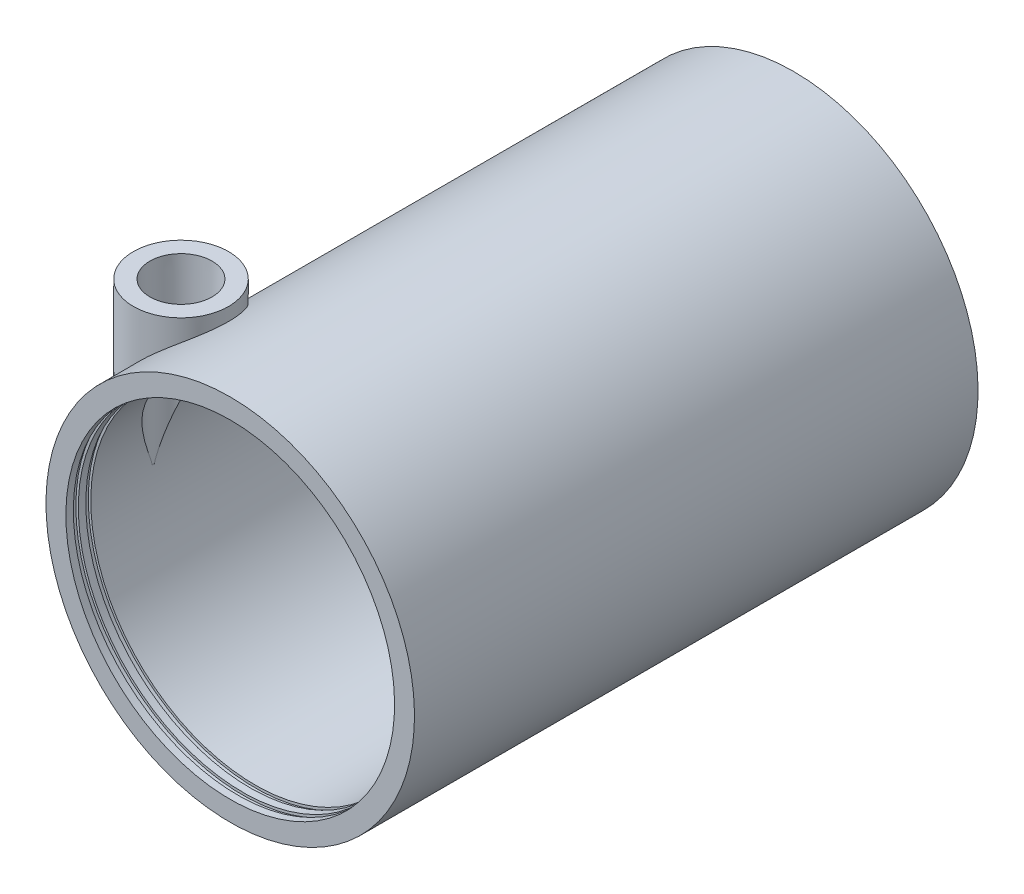
from build123d import *

# Parameters (mm, degrees)
SKETCH2_W                    = 1
SKETCH2_H                    = 0.5
WELD_BUNGS_INLET_REACH       = 161.673
WELD_START                   = 35
SKETCH3_R                    = 9.55625
WELD_BUNGS_OUTLET_REACH      = 161.673
WELD_BUNGS_OUTLET_END_RADIUS = 37
WELD_START_2                 = -35
SKETCH6_R                    = 9.55625


with BuildPart() as part:
    # Sketch1 → Main Base (revolve)
    with BuildSketch(Plane(origin=(0, 0, 0), x_dir=(0, 0, -1), z_dir=(1, 0, 0))):
        Polygon((0, 33), (109.16124, 33), (109.16124, 12.486702), (113.16124, 13.55849877), (113.16124, 37), (0, 37), align=None)
    revolve(axis=Axis((0, 0, -1.789473684), (0, 0, 1)))

    # Sketch2 → Radial O-Ring (revolve, cut)
    with BuildSketch(Plane(origin=(0, 0, 0), x_dir=(0, 0, -1), z_dir=(1, 0, 0)), mode=Mode.PRIVATE) as radial_o_ring_sk:
        with Locations((2, 33.25)):
            Rectangle(SKETCH2_W, SKETCH2_H)
        with Locations((4.5, 33.25)):
            Rectangle(SKETCH2_W, SKETCH2_H)
    revolve(radial_o_ring_sk.sketch.rotate(Axis((0, 0, 55), (0, 0, -1)), 90), axis=Axis((0, 0, 55), (0, 0, -1)), mode=Mode.SUBTRACT)

    # Sketch3 → Weld Bungs Inlet (add, up to next)
    with BuildSketch(Plane(origin=(0, 0, 0), x_dir=(1, 0, 0), z_dir=(0, 1, 0)).offset(WELD_START), mode=Mode.PRIVATE) as weld_bungs_inlet_sk1:
        with Locations(Location((-27.44375, 17.55625, 0), (0, 0, 270))):
            Circle(SKETCH3_R)
    weld_bungs_inlet_tool1 = extrude(weld_bungs_inlet_sk1.sketch, amount=-WELD_BUNGS_INLET_REACH, mode=Mode.PRIVATE) - part.part
    add(weld_bungs_inlet_tool1.solids().sort_by_distance((-27.44375, 35, -17.55625))[0])

    # Weld Bungs Outlet: up to this cylinder (the profile starts outside it)
    weld_bungs_outlet_end = Plane(origin=(0, 0, -97.60499), z_dir=(0, 0, -1)) * Cylinder(WELD_BUNGS_OUTLET_END_RADIUS, 398.346, mode=Mode.PRIVATE)
    # Sketch6 → Weld Bungs Outlet (add, up to the surface)
    with BuildSketch(Plane(origin=(0, 0, 0), x_dir=(1, 0, 0), z_dir=(0, 1, 0)).offset(WELD_START_2), mode=Mode.PRIVATE) as weld_bungs_outlet_sk1:
        with Locations(Location((-27.44375, 97.60499, 0), (0, 0, 180))):
            Circle(SKETCH6_R)
    weld_bungs_outlet_tool1 = extrude(weld_bungs_outlet_sk1.sketch, amount=WELD_BUNGS_OUTLET_REACH, mode=Mode.PRIVATE) - weld_bungs_outlet_end
    add(weld_bungs_outlet_tool1.solids().sort_by_distance((-27.44375, -35, -97.60499))[0])

    # Sketch5 → 1/4 NPT Tapped Hole1 (revolve, cut)
    with BuildSketch(Plane(origin=(-27.44375, 35, -17.55625), x_dir=(0, 0, 1), z_dir=(1, 0, 0))):
        Polygon((0, 0), (0, 38.341347279), (5.5626, 34.999), (5.5626, 10.02), (5.943676082, 10.02), (6.2436883, 0), align=None)
    revolve(axis=Axis((-27.44375, 41.35, -17.55625), (0, -1, 0)), mode=Mode.SUBTRACT)

    # Sketch8 → 1/4 NPT Tapped Hole2 (revolve, cut)
    with BuildSketch(Plane(origin=(-27.44375, -35, -97.60499), x_dir=(0, 0, -1), z_dir=(1, 0, 0))):
        Polygon((0, 0), (0, 38.341347279), (5.5626, 34.999), (5.5626, 10.02), (5.943676082, 10.02), (6.2436883, 0), align=None)
    revolve(axis=Axis((-27.44375, -41.35, -97.60499), (0, 1, 0)), mode=Mode.SUBTRACT)


solid = part.part
